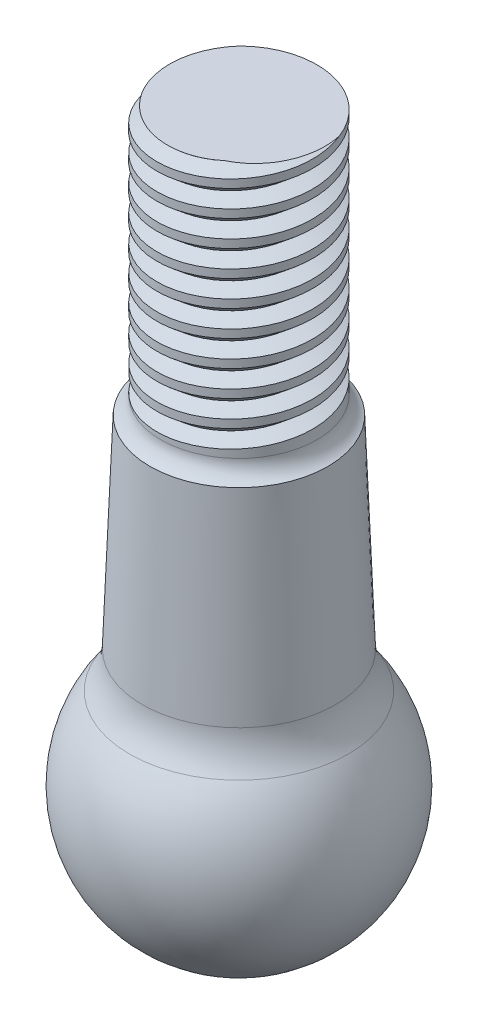
from build123d import *

# Parameters (mm, degrees)
CUT_SWEEP1_PITCH = 2
FILLET1_R        = 5


with BuildPart() as part:
    # Sketch1 → Revolve1 (revolve)
    with BuildSketch(Plane(origin=(0, 0, 0), x_dir=(0, 0, -1), z_dir=(1, 0, 0)), mode=Mode.PRIVATE) as revolve1_sk:
        with BuildLine():
            Line((6, 45), (6, 26))
            ThreePointArc((6, 26), (6.229025519, 25.203367168), (6.846165158, 24.65))
            Line((6.846165158, 24.65), (7.5, 7.348469228))
            ThreePointArc((7.5, 7.348469228), (9.680106583, -4.067620502), (0, -10.5))
            Line((0, -10.5), (0, 45))
            Line((0, 45), (6, 45))
        make_face()
    revolve(revolve1_sk.sketch.rotate(Axis((0, 12.96387941, 0), (0, -1, 0)), 180), axis=Axis((0, 12.96387941, 0), (0, -1, 0)))

    # Cut-Sweep1: arcs per turn and ends read off the stored shape
    # Cut-Sweep1: the profile of Sketch3 screwed along a right-hand helix through 10.25 turns, 10 arcs to a turn; built about Z, then put on its axis
    cut_sweep1_z = Axis((0, 0, 0), (0, 0, 1))
    cut_sweep1_corners = [(4.862617012, 0, -1.800768294), (6.396151775, 0, -3.084618414), (6.741231212, 0, -1.114613292)]
    with BuildLine(mode=Mode.PRIVATE) as cut_sweep1_profile:
        Line(cut_sweep1_corners[0], cut_sweep1_corners[1])
        Line(cut_sweep1_corners[1], cut_sweep1_corners[2])
        Line(cut_sweep1_corners[2], cut_sweep1_corners[0])
    cut_sweep1_cap = Face(cut_sweep1_profile.wire())
    cut_sweep1_turn_angles = [0, 18, 36, 54, 72, 90, 108, 126, 144, 162, 180, 198, 216, 234, 252, 270, 288, 306, 324, 342, 360]
    cut_sweep1_turn_weights = [1, 0.9510565162951535, 1, 0.9510565162951535, 1, 0.9510565162951535, 1, 0.9510565162951535, 1, 0.9510565162951535, 1, 0.9510565162951535, 1, 0.9510565162951535, 1, 0.9510565162951535, 1, 0.9510565162951535, 1, 0.9510565162951535, 1]
    cut_sweep1_turn_rails = [Edge.make_bspline([Vector(p[0], p[1], 0).rotate(cut_sweep1_z, cut_sweep1_turn_angles[k]) / cut_sweep1_turn_weights[k] + Vector(0, 0, p[2] + CUT_SWEEP1_PITCH * cut_sweep1_turn_angles[k] / 360) for k in range(21)], [0, 0, 0, 1, 1, 2, 2, 3, 3, 4, 4, 5, 5, 6, 6, 7, 7, 8, 8, 9, 9, 10, 10, 10], 2, cut_sweep1_turn_weights) for p in cut_sweep1_corners]
    cut_sweep1_turn_sides = [Face.make_surface_from_curves(cut_sweep1_turn_rails[p[0]], cut_sweep1_turn_rails[p[1]]) for p in [(0, 1), (1, 2), (2, 0)]]
    cut_sweep1_last_angles = [3600, 3618, 3636, 3654, 3672, 3681, 3690]
    cut_sweep1_last_weights = [1, 0.9510565162951535, 1, 0.9510565162951535, 1, 0.9876883405951378, 1]
    cut_sweep1_last_rails = [Edge.make_bspline([Vector(p[0], p[1], 0).rotate(cut_sweep1_z, cut_sweep1_last_angles[k]) / cut_sweep1_last_weights[k] + Vector(0, 0, p[2] + CUT_SWEEP1_PITCH * cut_sweep1_last_angles[k] / 360) for k in range(7)], [0, 0, 0, 1, 1, 2, 2, 3, 3, 3], 2, cut_sweep1_last_weights) for p in cut_sweep1_corners]
    cut_sweep1_last_sides = [Face.make_surface_from_curves(cut_sweep1_last_rails[p[0]], cut_sweep1_last_rails[p[1]]) for p in [(0, 1), (1, 2), (2, 0)]]
    cut_sweep1 = Plane(origin=(0, 45, 0), x_dir=(0, 0, 1), z_dir=(0, -1, 0)) * Solid(Shell([*[p.moved(Location((0, 0, CUT_SWEEP1_PITCH * i))) for i in range(10) for p in cut_sweep1_turn_sides], *cut_sweep1_last_sides, cut_sweep1_cap, cut_sweep1_cap.rotate(cut_sweep1_z, 3690).moved(Location((0, 0, CUT_SWEEP1_PITCH * 3690 / 360)))]))
    add(cut_sweep1, mode=Mode.SUBTRACT)

    # Fillet1
    fillet1_edges = [part.edges().sort_by_distance(p)[0] for p in [
        (0, 7.348469228, -7.5),
    ]]
    fillet(fillet1_edges, radius=FILLET1_R)


solid = part.part
